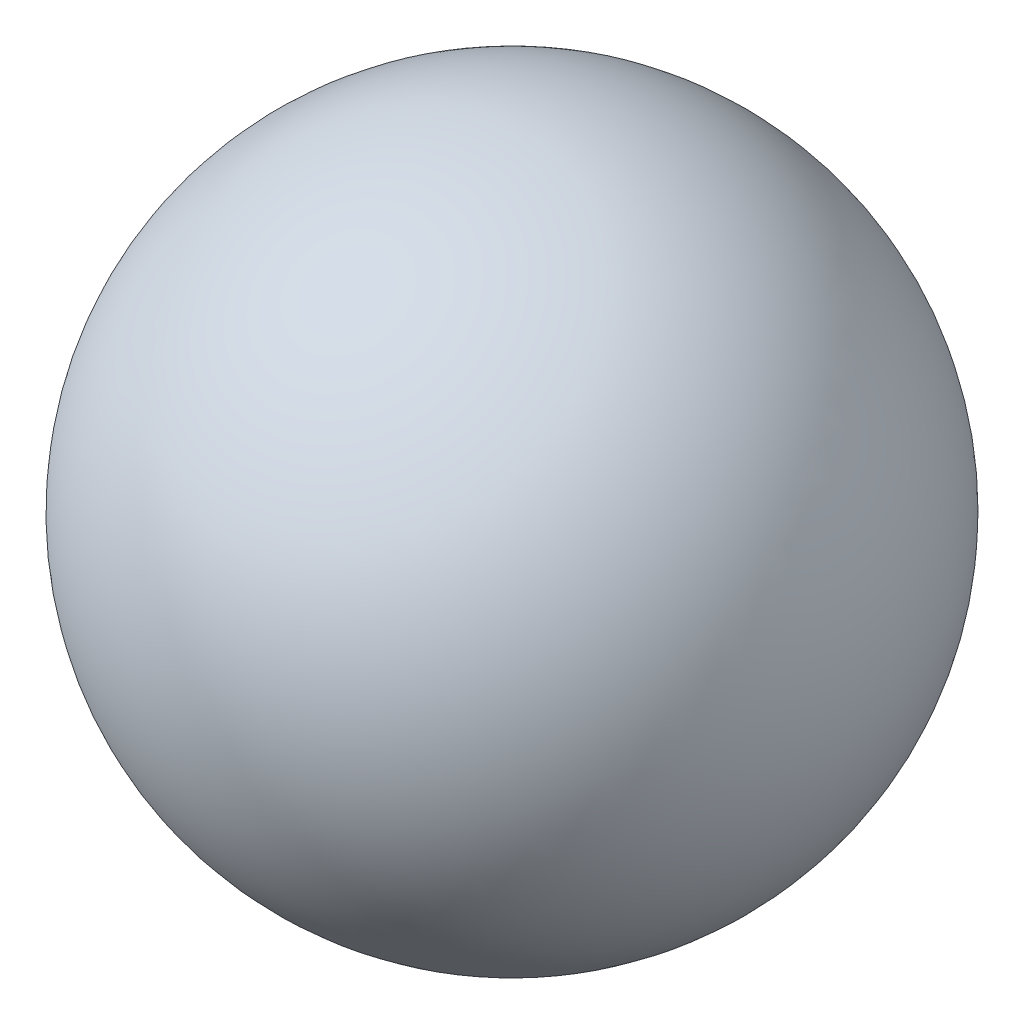
from build123d import *
from build123d.topology import SkipClean

# Parameters (mm, degrees)
CUT_EXTRUDE1_REACH      = 10.66
CUT_EXTRUDE1_END_RADIUS = 5
SKETCH2_R               = 2
CUT_EXTRUDE2_START      = 2.5
SKETCH2_2_R             = 2
CUT_EXTRUDE2_DEPTH      = 2.5
THREAD1_PITCH           = 0.7


with BuildPart() as part:
    # Sketch1 → Revolve1 (revolve)
    with BuildSketch(Plane.XY):
        with BuildLine():
            Line((0, 5), (0, -5))
            ThreePointArc((0, -5), (5, 0), (0, 5))
        make_face()
    revolve(axis=Axis((0, 5, 0), (0, -1, 0)))

    # Cut-Extrude1: up to this sphere (the profile starts inside it)
    cut_extrude1_end = Location((0, 0, 0)) * Sphere(CUT_EXTRUDE1_END_RADIUS, mode=Mode.PRIVATE)
    # Sketch2 → Cut-Extrude1 (cut, up to the surface)
    with BuildSketch(Plane(origin=(0, 0, 0), x_dir=(1, 0, 0), z_dir=(0, 1, 0)), mode=Mode.PRIVATE) as cut_extrude1_sk1:
        with Locations(Location((0, 0, 0), (0, 0, 270))):
            Circle(SKETCH2_R)
    cut_extrude1_tool1 = extrude(cut_extrude1_sk1.sketch, amount=-CUT_EXTRUDE1_REACH, mode=Mode.PRIVATE) & cut_extrude1_end
    add(cut_extrude1_tool1.solids().sort_by_distance((0, 0, 0))[0], mode=Mode.SUBTRACT)

    # Sketch2<2> → Cut-Extrude2 (cut)
    with BuildSketch(Plane(origin=(0, 0, 0), x_dir=(1, 0, 0), z_dir=(0, 1, 0)).offset(CUT_EXTRUDE2_START)):
        with Locations(Location((0, 0, 0), (0, 0, 270))):
            Circle(SKETCH2_2_R)
    extrude(amount=-CUT_EXTRUDE2_DEPTH, mode=Mode.SUBTRACT)

    # Thread1: the profile of Thread Profile1 profile screwed along a right-hand helix of 10.117965 turns, 6 arcs to a turn; built about Z, then put on its axis
    with SkipClean():  # the faces are left unmerged after this step: merging them gives an invalid solid
        thread1_z = Axis((0, 0, 0), (0, 0, 1))
        thread1_corners = [(2.0003, 0, -0.000173205), (2.0003, 0, 0.612673203), (1.621113887, 0, 0.393749999), (1.621113887, 0, 0.218749999)]
        with BuildLine(mode=Mode.PRIVATE) as thread1_profile:
            Line(thread1_corners[0], thread1_corners[1])
            Line(thread1_corners[1], thread1_corners[2])
            Line(thread1_corners[2], thread1_corners[3])
            Line(thread1_corners[3], thread1_corners[0])
        thread1_cap = Face(thread1_profile.wire())
        thread1_turn_angles = [0, 30, 60, 90, 120, 150, 180, 210, 240, 270, 300, 330, 360]
        thread1_turn_weights = [1, 0.8660254037844387, 1, 0.8660254037844387, 1, 0.8660254037844387, 1, 0.8660254037844387, 1, 0.8660254037844387, 1, 0.8660254037844387, 1]
        thread1_turn_rails = [Edge.make_bspline([Vector(p[0], p[1], 0).rotate(thread1_z, thread1_turn_angles[k]) / thread1_turn_weights[k] + Vector(0, 0, p[2] + THREAD1_PITCH * thread1_turn_angles[k] / 360) for k in range(13)], [0, 0, 0, 1, 1, 2, 2, 3, 3, 4, 4, 5, 5, 6, 6, 6], 2, thread1_turn_weights) for p in thread1_corners]
        thread1_turn_sides = [Face.make_surface_from_curves(thread1_turn_rails[p[0]], thread1_turn_rails[p[1]]) for p in [(0, 1), (1, 2), (2, 3), (3, 0)]]
        thread1_last_angles = [3600, 3621.233750132, 3642.467500263]
        thread1_last_weights = [1, 0.932110624193655, 1]
        thread1_last_rails = [Edge.make_bspline([Vector(p[0], p[1], 0).rotate(thread1_z, thread1_last_angles[k]) / thread1_last_weights[k] + Vector(0, 0, p[2] + THREAD1_PITCH * thread1_last_angles[k] / 360) for k in range(3)], [0, 0, 0, 1, 1, 1], 2, thread1_last_weights) for p in thread1_corners]
        thread1_last_sides = [Face.make_surface_from_curves(thread1_last_rails[p[0]], thread1_last_rails[p[1]]) for p in [(0, 1), (1, 2), (2, 3), (3, 0)]]
        thread1 = Plane(origin=(0, -4.582575695, 0), x_dir=(1, 0, 0), z_dir=(0, 1, 0)) * Solid(Shell([*[p.moved(Location((0, 0, THREAD1_PITCH * i))) for i in range(10) for p in thread1_turn_sides], *thread1_last_sides, thread1_cap, thread1_cap.rotate(thread1_z, 3642.467500263).moved(Location((0, 0, THREAD1_PITCH * 3642.467500263 / 360)))]))
        add(thread1)


solid = part.part
